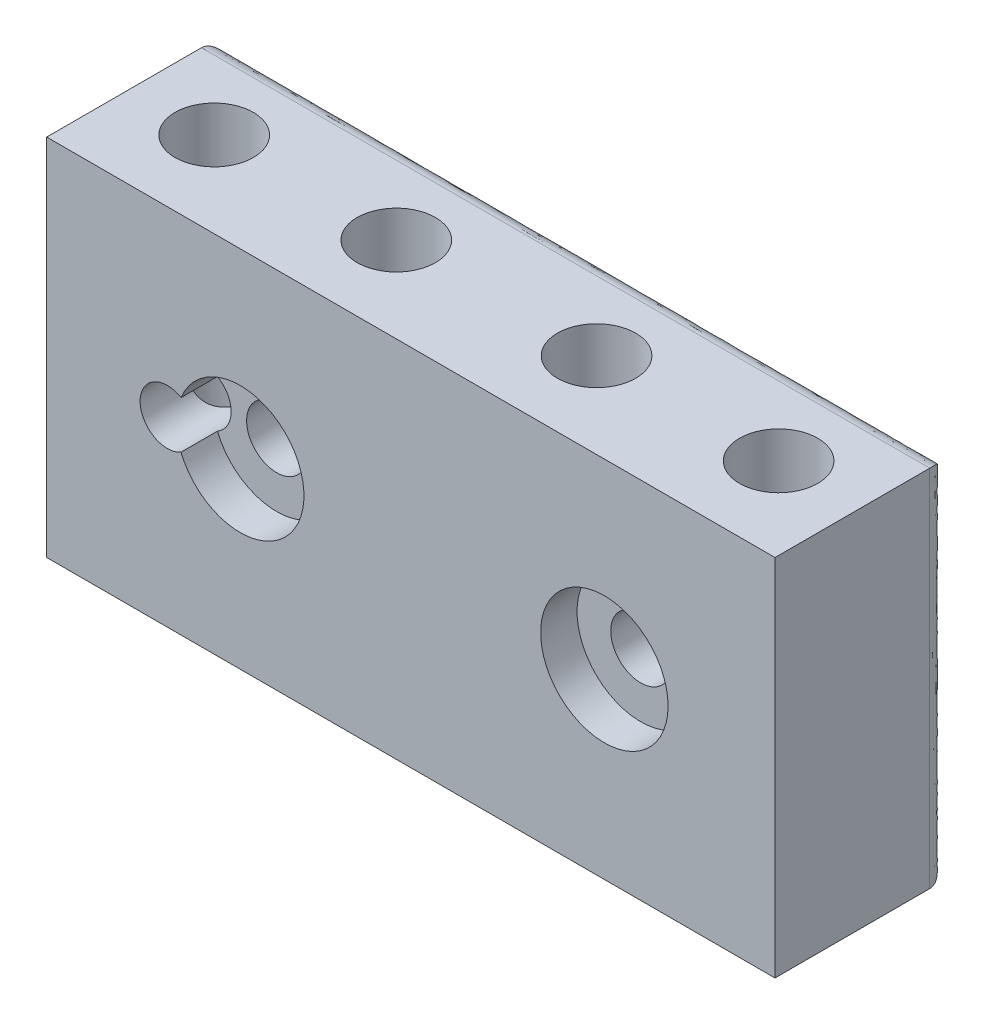
from build123d import *

# Parameters (mm, degrees)
SKETCH1_W           = 40
SKETCH1_H           = 20
BOSS_EXTRUDE1_DEPTH = 9.5
CUT_EXTRUDE1_DEPTH  = 2
FILLET1_R           = 1
SKETCH4_R           = 2.15
CUT_EXTRUDE2_DEPTH  = 30.837057496
SKETCH5_R           = 1.5
SKETCH5_R_2         = 1.65
CUT_EXTRUDE3_DEPTH  = 25.295061227
SKETCH6_R           = 3.5
CUT_EXTRUDE4_DEPTH  = 2


with BuildPart() as part:
    # Sketch1 → Boss-Extrude1 (new body)
    with BuildSketch(Plane.XY):
        Rectangle(SKETCH1_W, SKETCH1_H)
    extrude(amount=BOSS_EXTRUDE1_DEPTH)

    # Sketch3 → Cut-Extrude1 (cut)
    with BuildSketch(Plane(origin=(0, 0, 0), x_dir=(-1, 0, 0), z_dir=(0, 0, -1))):
        with BuildLine():
            Line((13.371397425, -3.45), (1.371397425, -3.45))
            add(Edge.make_bspline(
                [(-6.426606991, -6.332711355), (-3.012827406, -3.55467535), (1.371397425, -3.45)],
                knots=[0, 0, 0, 1, 1, 1], degree=2))
            ThreePointArc((-6.426606991, -6.332711355), (-18.228602575, 0), (-6.426606991, 6.332711355))
            add(Edge.make_bspline(
                [(-6.426606991, 6.332711355), (-3.012827406, 3.55467535), (1.371397425, 3.45)],
                knots=[0, 0, 0, 1, 1, 1], degree=2))
            Line((1.371397425, 3.45), (13.371397425, 3.45))
            ThreePointArc((13.371397425, 3.45), (16.821397425, 0), (13.371397425, -3.45))
        make_face()
    extrude(amount=-CUT_EXTRUDE1_DEPTH, mode=Mode.SUBTRACT)

    # Fillet1
    fillet1_edges = [part.edges().sort_by_distance(p)[0] for p in [
        (-20, 0, 0),
        (0, -10, 0),
        (0, 10, 0),
        (20, 0, 0),
    ]]
    fillet(fillet1_edges, radius=FILLET1_R)

    # Sketch4 → Cut-Extrude2 (cut, through all)
    with BuildSketch(Plane(origin=(0, 10, 0), x_dir=(1, 0, 0), z_dir=(0, 1, 0))):
        with Locations((-15.5, -4.8)):
            Circle(SKETCH4_R)
        with Locations((-5.5, -4.8)):
            Circle(SKETCH4_R)
        with Locations((5.5, -4.8)):
            Circle(SKETCH4_R)
        with Locations((15.5, -4.8)):
            Circle(SKETCH4_R)
    extrude(amount=-CUT_EXTRUDE2_DEPTH, mode=Mode.SUBTRACT)

    # Sketch5 → Cut-Extrude3 (cut, through all)
    with BuildSketch(Plane(origin=(0, 0, 0), x_dir=(-1, 0, 0), z_dir=(0, 0, -1))):
        with Locations((13.371397425, 0)):
            Circle(SKETCH5_R)
        with Locations((9.371397425, 0)):
            Circle(SKETCH5_R_2)
        with Locations((-10.628602575, 0)):
            Circle(SKETCH5_R_2)
    extrude(amount=-CUT_EXTRUDE3_DEPTH, mode=Mode.SUBTRACT)

    # Sketch6 → Cut-Extrude4 (cut)
    with BuildSketch(Plane.XY.offset(9.5)):
        with Locations((10.628602575, 0)):
            Circle(SKETCH6_R)
        with Locations((-9.371397425, 0)):
            Circle(SKETCH6_R)
    extrude(amount=-CUT_EXTRUDE4_DEPTH, mode=Mode.SUBTRACT)


solid = part.part
